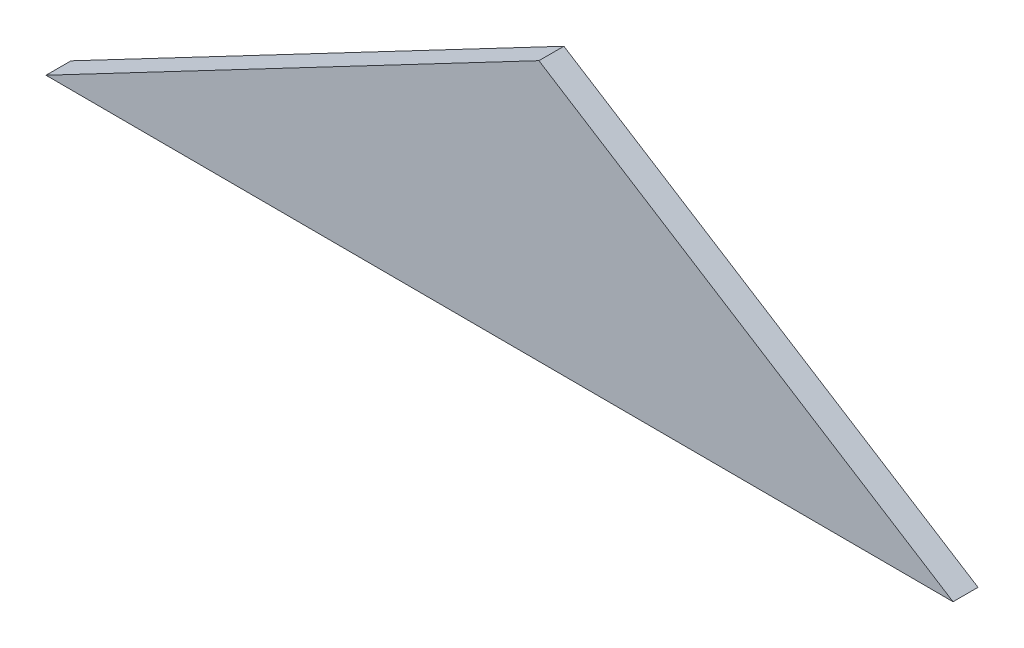
from build123d import *

# Parameters (mm, degrees)
BOSS_EXTRUDE1_DEPTH = 5


with BuildPart() as part:
    # Sketch1 → Boss-Extrude1 (new body)
    with BuildSketch(Plane.XY):
        Polygon((-125.966379971, -6.066634785), (-27.224046307, 45.832672746), (55.73223798, -6.556287504), align=None)
    extrude(amount=BOSS_EXTRUDE1_DEPTH)


solid = part.part
